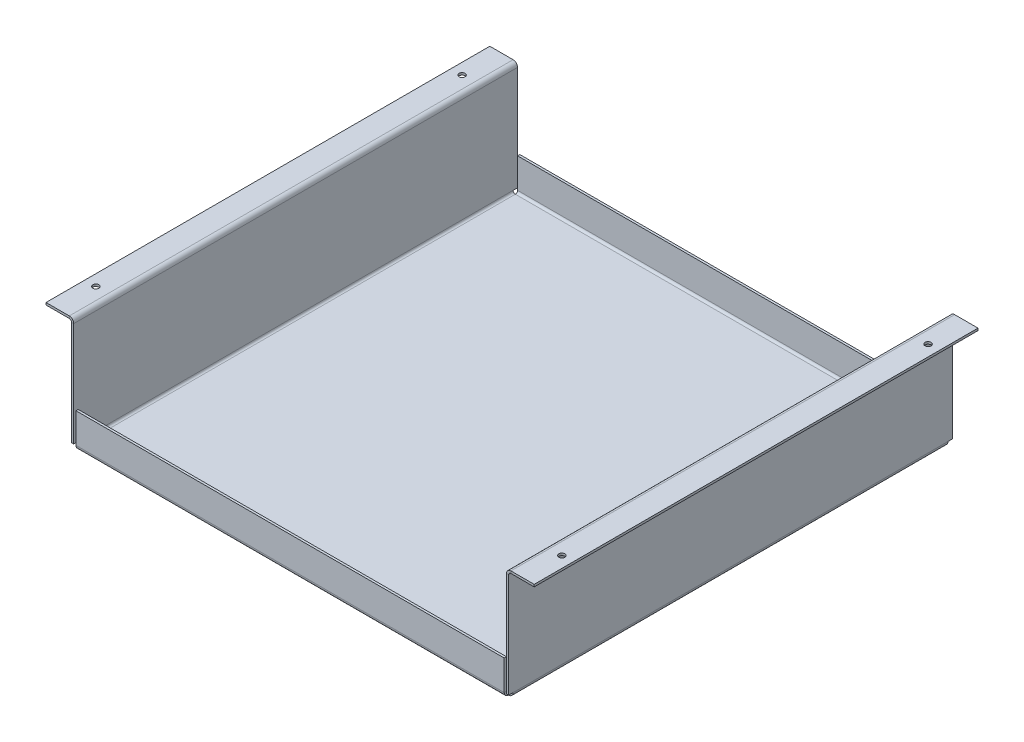
from build123d import *

# Parameters (mm, degrees)
SM_BASE_FLANGE_1_DEPTH   = 200
SM_START                 = -197
SM_EDGE_FLANGE_1_DEPTH   = 394
SM_EDGE_FLANGE_1_2_DEPTH = 4
SM_START_2               = 193
SM_EDGE_FLANGE_1_3_DEPTH = 4
SM_START_3               = -193
SM_EDGE_FLANGE_1_4_DEPTH = 386
SKETCH_12_R              = 2.75
CUT_EXTRUDE_1_DEPTH      = 314.687742827


# Read off the part's stored shape, not the designer's step: Ребро-кромка1
# Sheet-metal steps are written as plain solids
with BuildPart() as part:
    # Sketch 1 → Базовая кромка1 (new, symmetric)
    with BuildSketch(Plane.XY):
        with BuildLine():
            Line((-220, 100), (-199, 100))
            ThreePointArc((-199, 100), (-196.171572875, 98.828427125), (-195, 96))
            Line((-195, 96), (-195, 2))
            ThreePointArc((-195, 2), (-194.414213562, 0.585786438), (-193, 0))
            Line((-193, 0), (193, 0))
            ThreePointArc((193, 0), (194.414213562, 0.585786438), (195, 2))
            Line((195, 2), (195, 96))
            ThreePointArc((195, 96), (196.171572875, 98.828427125), (199, 100))
            Line((199, 100), (220, 100))
            Line((220, 100), (220, 98))
            Line((220, 98), (199, 98))
            ThreePointArc((199, 98), (197.585786438, 97.414213562), (197, 96))
            Line((197, 96), (197, 2))
            ThreePointArc((197, 2), (195.828427125, -0.828427125), (193, -2))
            Line((193, -2), (-193, -2))
            ThreePointArc((-193, -2), (-195.828427125, -0.828427125), (-197, 2))
            Line((-197, 2), (-197, 96))
            ThreePointArc((-197, 96), (-197.585786438, 97.414213562), (-199, 98))
            Line((-199, 98), (-220, 98))
            Line((-220, 98), (-220, 100))
        make_face()
    extrude(amount=SM_BASE_FLANGE_1_DEPTH, both=True)

    # Ребро-кромка1 outline → Ребро-кромка1 (cut)
    with BuildSketch(Plane.YZ.offset(SM_START)):
        with BuildLine():
            ThreePointArc((2, -200), (-0.828427125, -198.828427125), (-2, -196))
            Line((-2, -196), (-2, -200))
            Line((-2, -200), (2, -200))
        make_face()
        with BuildLine():
            ThreePointArc((0, -196), (0.585786438, -197.414213562), (2, -198))
            Line((2, -198), (2, -196))
            Line((2, -196), (0, -196))
        make_face()
        with BuildLine():
            ThreePointArc((2, 198), (0.585786438, 197.414213562), (0, 196))
            Line((0, 196), (2, 196))
            Line((2, 196), (2, 198))
        make_face()
        with BuildLine():
            Line((-2, 200), (-2, 196))
            ThreePointArc((-2, 196), (-0.828427125, 198.828427125), (2, 200))
            Line((2, 200), (-2, 200))
        make_face()
    extrude(amount=SM_EDGE_FLANGE_1_DEPTH, mode=Mode.SUBTRACT)

    # Sm Edge Flange 1 2 outline → Sm Edge Flange 1 2 (cut)
    with BuildSketch(Plane.YZ.offset(SM_START)):
        with BuildLine():
            Line((2, -200), (2, -198))
            ThreePointArc((2, -198), (0.585786438, -197.414213562), (0, -196))
            Line((0, -196), (-2, -196))
            ThreePointArc((-2, -196), (-0.828427125, -198.828427125), (2, -200))
        make_face()
        with BuildLine():
            ThreePointArc((2, 200), (-0.828427125, 198.828427125), (-2, 196))
            Line((-2, 196), (0, 196))
            ThreePointArc((0, 196), (0.585786438, 197.414213562), (2, 198))
            Line((2, 198), (2, 200))
        make_face()
    extrude(amount=SM_EDGE_FLANGE_1_2_DEPTH, mode=Mode.SUBTRACT)

    # Sm Edge Flange 1 3 outline → Sm Edge Flange 1 3 (cut)
    with BuildSketch(Plane.YZ.offset(SM_START_2)):
        with BuildLine():
            Line((2, -200), (2, -198))
            ThreePointArc((2, -198), (0.585786438, -197.414213562), (0, -196))
            Line((0, -196), (-2, -196))
            ThreePointArc((-2, -196), (-0.828427125, -198.828427125), (2, -200))
        make_face()
        with BuildLine():
            ThreePointArc((2, 200), (-0.828427125, 198.828427125), (-2, 196))
            Line((-2, 196), (0, 196))
            ThreePointArc((0, 196), (0.585786438, 197.414213562), (2, 198))
            Line((2, 198), (2, 200))
        make_face()
    extrude(amount=SM_EDGE_FLANGE_1_3_DEPTH, mode=Mode.SUBTRACT)

    # Sm Edge Flange 1 4 outline → Sm Edge Flange 1 4 (add)
    with BuildSketch(Plane.YZ.offset(SM_START_3)):
        with BuildLine():
            ThreePointArc((0, -199.464101616), (0.96472382, -199.863703305), (2, -200))
            Line((2, -200), (29, -200))
            Line((29, -200), (29, -198))
            Line((29, -198), (2, -198))
            ThreePointArc((2, -198), (0.585786438, -197.414213562), (0, -196))
            Line((0, -196), (0, -199.464101616))
        make_face()
        with BuildLine():
            Line((0, 199.464101616), (0, 196))
            ThreePointArc((0, 196), (0.585786438, 197.414213562), (2, 198))
            Line((2, 198), (29, 198))
            Line((29, 198), (29, 200))
            Line((29, 200), (2, 200))
            ThreePointArc((2, 200), (0.96472382, 199.863703305), (0, 199.464101616))
        make_face()
    extrude(amount=SM_EDGE_FLANGE_1_4_DEPTH)

    # Эскиз12 → Вырез-Вытянуть1 (cut, through all)
    with BuildSketch(Plane.XZ.offset(-98)):
        with Locations((210, 165)):
            Circle(SKETCH_12_R)
        with Locations(Location((-210, 165, 0), (0, 0, 180))):
            Circle(SKETCH_12_R)
        with Locations(Location((210, -165, 0), (0, 0, 180))):
            Circle(SKETCH_12_R)
        with Locations((-210, -165)):
            Circle(SKETCH_12_R)
    extrude(amount=-CUT_EXTRUDE_1_DEPTH, mode=Mode.SUBTRACT)


solid = part.part
